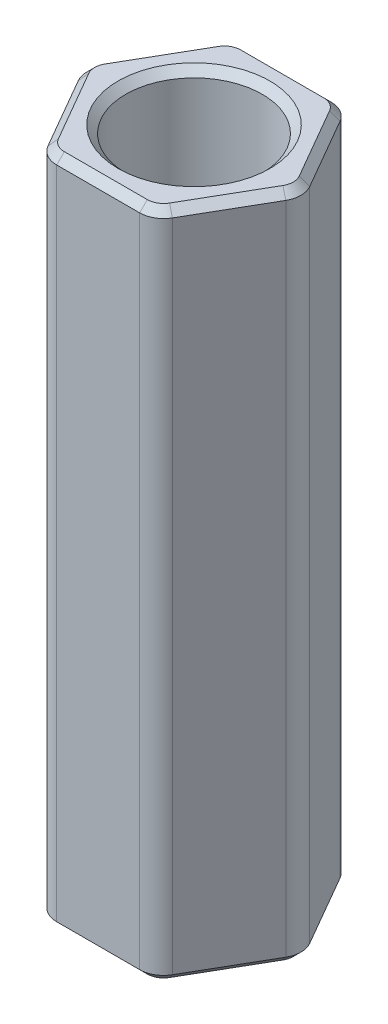
from build123d import *

# Parameters (mm, degrees)
BOSS_EXTRUDE1_DEPTH   = 5.55625
F_4_40_TAPPED_HOLE1_D = 2.2606
FILLET1_R             = 0.396875
CHAMFER1_SIZE         = 0.127


with BuildPart() as part:
    # Sketch1 → Boss-Extrude1 (new, symmetric)
    with BuildSketch(Plane(origin=(0, 0, 0), x_dir=(1, 0, 0), z_dir=(0, 1, 0))):
        Polygon((0.916543552, 1.5875), (-0.916543552, 1.5875), (-1.833087105, 0), (-0.916543552, -1.5875), (0.916543552, -1.5875), (1.833087105, 0), align=None)
    extrude(amount=BOSS_EXTRUDE1_DEPTH, both=True)

    # #4-40 Tapped Hole1 (through all)
    with Locations(Plane(origin=(0, 5.55625, 0), x_dir=(1, 0, 0), z_dir=(0, 1, 0))):
        with Locations((0, 0)):
            Hole(F_4_40_TAPPED_HOLE1_D / 2)

    # Fillet1
    fillet1_edges = [part.edges().sort_by_distance(p)[0] for p in [
        (-0.916543552, 0, -1.5875),
        (0.916543552, 0, -1.5875),
        (1.833087105, 0, 0),
        (0.916543552, 0, 1.5875),
        (-0.916543552, 0, 1.5875),
        (-1.833087105, 0, 0),
    ]]
    fillet(fillet1_edges, radius=FILLET1_R)

    # Chamfer1
    chamfer1_edges = [part.edges().sort_by_distance(p)[0] for p in [
        (1.1303, 5.55625, 0),
        (1.1303, -5.55625, 0),
        (1.374815329, -5.55625, -0.79375),
        (0.885845164, -5.55625, -1.534328832),
        (1.771690329, -5.55625, 0),
        (0, -5.55625, -1.5875),
        (1.374815329, -5.55625, 0.79375),
        (-0.885845164, -5.55625, -1.534328832),
        (0.885845164, -5.55625, 1.534328832),
        (-1.374815329, -5.55625, -0.79375),
        (0, -5.55625, 1.5875),
        (-1.771690329, -5.55625, 0),
        (-0.885845164, -5.55625, 1.534328832),
        (-1.374815329, -5.55625, 0.79375),
        (1.374815329, 5.55625, -0.79375),
        (0.885845164, 5.55625, -1.534328832),
        (1.771690329, 5.55625, 0),
        (0, 5.55625, -1.5875),
        (1.374815329, 5.55625, 0.79375),
        (-0.885845164, 5.55625, -1.534328832),
        (0.885845164, 5.55625, 1.534328832),
        (-1.374815329, 5.55625, -0.79375),
        (0, 5.55625, 1.5875),
        (-1.771690329, 5.55625, 0),
        (-0.885845164, 5.55625, 1.534328832),
        (-1.374815329, 5.55625, 0.79375),
    ]]
    chamfer(chamfer1_edges, length=CHAMFER1_SIZE)


solid = part.part
